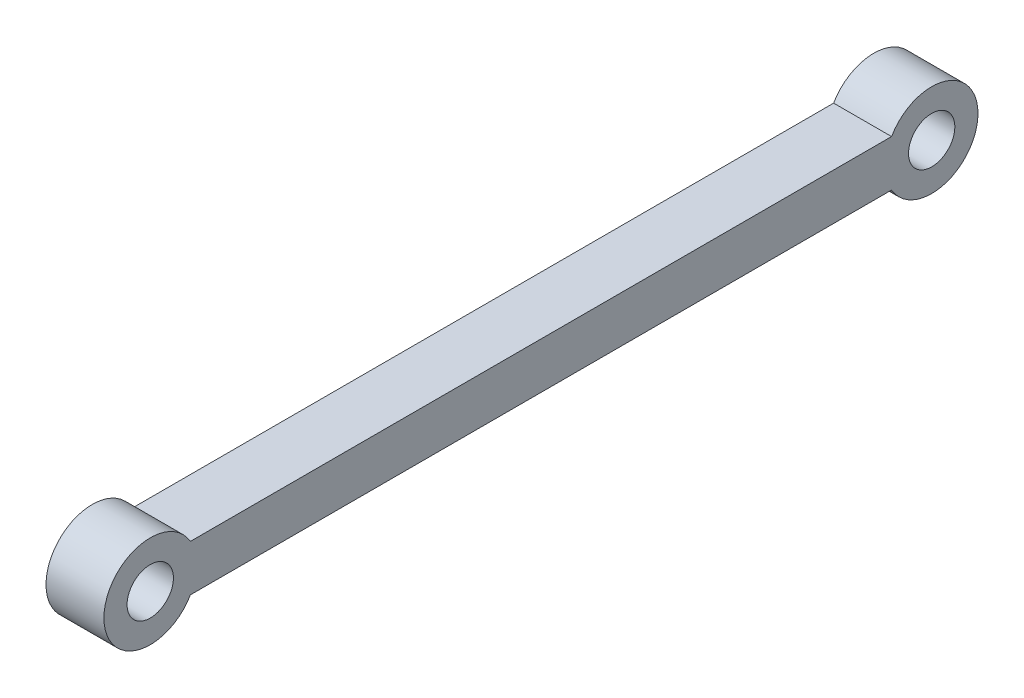
from build123d import *

# Parameters (mm, degrees)
SKETCH1_R           = 1
BOSS_EXTRUDE1_DEPTH = 1.25


with BuildPart() as part:
    # Sketch1 → Boss-Extrude1 (new, symmetric)
    with BuildSketch(Plane(origin=(0, 0, 0), x_dir=(0, 0, -1), z_dir=(1, 0, 0))):
        with BuildLine():
            Line((-15.133949192, 1), (15.133949192, 1))
            ThreePointArc((15.133949192, 1), (18.866, 0), (15.133949192, -1))
            Line((15.133949192, -1), (-15.133949192, -1))
            ThreePointArc((-15.133949192, -1), (-18.866, 0), (-15.133949192, 1))
        make_face()
        with Locations((-16.866, 0)):
            Circle(SKETCH1_R, mode=Mode.SUBTRACT)
        with Locations((16.866, 0)):
            Circle(SKETCH1_R, mode=Mode.SUBTRACT)
    extrude(amount=BOSS_EXTRUDE1_DEPTH, both=True)


solid = part.part
